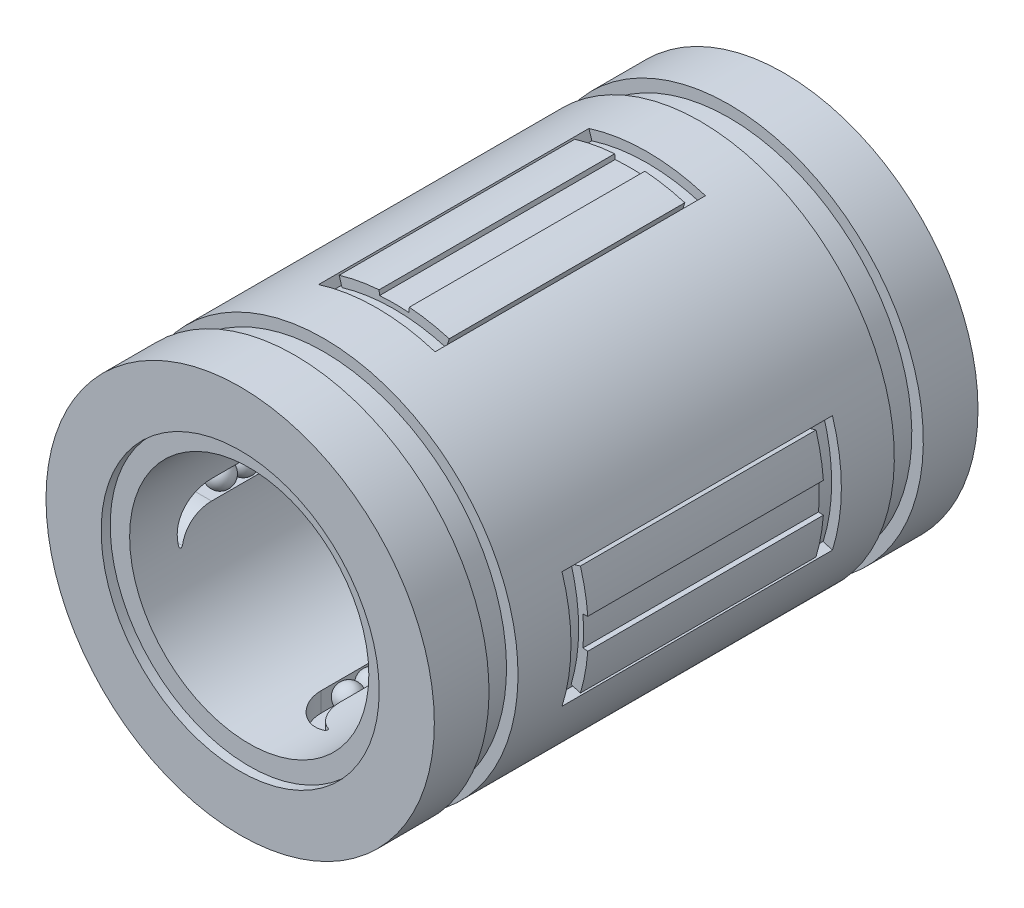
from build123d import *

# Parameters (mm, degrees)
SKETCH3_R               = 7.9375
SKETCH3_R_2             = 4.8895
BOSS_EXTRUDE1_DEPTH     = 11.1125
CUT_EXTRUDE1_START      = -0.370417
SKETCH4_R               = 5.68325
SKETCH4_R_2             = 4.8895
CUT_EXTRUDE1_DEPTH      = 0.370417
CUT_EXTRUDE2_DEPTH      = 5.526617
BOSS_EXTRUDE2_DEPTH     = 4.815417
CUT_EXTRUDE3_REACH      = 17.795
CUT_EXTRUDE3_END_RADIUS = 5.68325
LPATTERN1_COUNT         = 8
LPATTERN1_PITCH         = 0.9525
CIRPATTERN1_COUNT       = 4
CIRPATTERN2_COUNT       = 4
SKETCH9_W               = 1.185333259
SKETCH9_H               = 0.4699


with BuildPart() as part:
    # Sketch3 → Boss-Extrude1 (new, symmetric)
    with BuildSketch(Plane.XY):
        Circle(SKETCH3_R)
        Circle(SKETCH3_R_2, mode=Mode.SUBTRACT)
    extrude(amount=BOSS_EXTRUDE1_DEPTH, both=True)

    # Sketch4 → Cut-Extrude1 (cut)
    with BuildSketch(Plane.XY.offset(11.1125).offset(CUT_EXTRUDE1_START)):
        Circle(SKETCH4_R)
        Circle(SKETCH4_R_2, mode=Mode.SUBTRACT)
    cut_extrude1 = extrude(amount=CUT_EXTRUDE1_DEPTH, mode=Mode.SUBTRACT)

    # Mirror1: Cut-Extrude1 across plane
    add(cut_extrude1.mirror(Plane.XY), mode=Mode.SUBTRACT)

    # Sketch5 → Cut-Extrude2 (cut, symmetric)
    with BuildSketch(Plane.XY):
        with BuildLine():
            Line((-2.38125, 7.571892411), (-2.2621875, 7.193297791))
            ThreePointArc((-2.2621875, 7.193297791), (0, 7.540625), (2.2621875, 7.193297791))
            Line((2.2621875, 7.193297791), (2.38125, 7.571892411))
            ThreePointArc((2.38125, 7.571892411), (0, 7.9375), (-2.38125, 7.571892411))
        make_face()
    cut_extrude2 = extrude(amount=CUT_EXTRUDE2_DEPTH, both=True, mode=Mode.SUBTRACT)

    # Sketch6 → Boss-Extrude2 (add, symmetric)
    with BuildSketch(Plane.XY):
        with BuildLine():
            Line((2.24873958, 7.612297718), (2.136302601, 7.231682832))
            ThreePointArc((2.136302601, 7.231682832), (0, 7.540625), (-2.136302601, 7.231682832))
            Line((-2.136302601, 7.231682832), (-2.24873958, 7.612297718))
            ThreePointArc((-2.24873958, 7.612297718), (-1.440718967, 7.805654047), (-0.616913535, 7.913489997))
            Line((-0.616913535, 7.913489997), (-0.601490697, 7.715652748))
            ThreePointArc((-0.601490697, 7.715652748), (0, 7.7390625), (0.601490697, 7.715652748))
            Line((0.601490697, 7.715652748), (0.616913535, 7.913489997))
            ThreePointArc((0.616913535, 7.913489997), (1.440718967, 7.805654047), (2.24873958, 7.612297718))
        make_face()
    boss_extrude2 = extrude(amount=BOSS_EXTRUDE2_DEPTH, both=True)

    # Cut-Extrude3: up to this cylinder (the profile starts inside it)
    cut_extrude3_end = Plane(origin=(0, 0, 0), z_dir=(0, 0, 1)) * Cylinder(CUT_EXTRUDE3_END_RADIUS, 47.9565, mode=Mode.PRIVATE)
    # Sketch7 → Cut-Extrude3 (cut, up to the surface)
    with BuildSketch(Plane(origin=(0, 0, 0), x_dir=(0, 0, -1), z_dir=(1, 0, 0)), mode=Mode.PRIVATE) as cut_extrude3_sk1:
        with BuildLine():
            Line((-7.408333259, -0.396875), (7.408333259, -0.396875))
            ThreePointArc((7.408333259, -0.396875), (8.197326094, -0.624417904), (8.743984095, -1.237158059))
            ThreePointArc((8.743984095, -1.237158059), (8.824106884, -1.27796122), (8.88457892, -1.211420313))
            ThreePointArc((8.88457892, -1.211420313), (8.499882051, -0.082864857), (7.408333259, 0.396875))
            Line((7.408333259, 0.396875), (-7.408333259, 0.396875))
            ThreePointArc((-7.408333259, 0.396875), (-8.499882051, -0.082864857), (-8.88457892, -1.211420313))
            ThreePointArc((-8.88457892, -1.211420313), (-8.824106884, -1.27796122), (-8.743984095, -1.237158059))
            ThreePointArc((-8.743984095, -1.237158059), (-8.197326094, -0.624417904), (-7.408333259, -0.396875))
        make_face()
    cut_extrude3_tool1 = extrude(cut_extrude3_sk1.sketch, amount=-CUT_EXTRUDE3_REACH, mode=Mode.PRIVATE) & cut_extrude3_end
    cut_extrude3 = cut_extrude3_tool1.solids().sort_by_distance((0, -0.04777, 0))[0]
    add(cut_extrude3, mode=Mode.SUBTRACT)

    # Sketch8 → Revolve1 (revolve)
    with BuildSketch(Plane.XY):
        with BuildLine():
            Line((-5.27137107, 0.50887107), (-5.27137107, -0.50887107))
            ThreePointArc((-5.27137107, -0.50887107), (-4.7625, 0), (-5.27137107, 0.50887107))
        make_face()
    revolve1 = revolve(axis=Axis((-5.27137107, 0.50887107, 0), (0, -1, 0)))

    # LPattern1: Revolve1 ×8
    with Locations(*[(0, 0, -i * LPATTERN1_PITCH) for i in range(1, LPATTERN1_COUNT)]):
        add(revolve1)

    # Mirror2 copy 1 sketch → Mirror2 copy 1 (revolve)
    with BuildSketch(Plane(origin=(0, 0, 0.9525), x_dir=(1, 0, 0), z_dir=(0, 0, -1))):
        with BuildLine():
            Line((-5.27137107, -0.50887107), (-5.27137107, 0.50887107))
            ThreePointArc((-5.27137107, 0.50887107), (-4.7625, 0), (-5.27137107, -0.50887107))
        make_face()
    revolve(axis=Axis((-5.27137107, 0.50887107, 0.9525), (0, 1, 0)))

    # Mirror2 copy 2 sketch → Mirror2 copy 2 (revolve)
    with BuildSketch(Plane(origin=(0, 0, 1.905), x_dir=(1, 0, 0), z_dir=(0, 0, -1))):
        with BuildLine():
            Line((-5.27137107, -0.50887107), (-5.27137107, 0.50887107))
            ThreePointArc((-5.27137107, 0.50887107), (-4.7625, 0), (-5.27137107, -0.50887107))
        make_face()
    revolve(axis=Axis((-5.27137107, 0.50887107, 1.905), (0, 1, 0)))

    # Mirror2 copy 3 sketch → Mirror2 copy 3 (revolve)
    with BuildSketch(Plane(origin=(0, 0, 2.8575), x_dir=(1, 0, 0), z_dir=(0, 0, -1))):
        with BuildLine():
            Line((-5.27137107, -0.50887107), (-5.27137107, 0.50887107))
            ThreePointArc((-5.27137107, 0.50887107), (-4.7625, 0), (-5.27137107, -0.50887107))
        make_face()
    revolve(axis=Axis((-5.27137107, 0.50887107, 2.8575), (0, 1, 0)))

    # Mirror2 copy 4 sketch → Mirror2 copy 4 (revolve)
    with BuildSketch(Plane(origin=(0, 0, 3.81), x_dir=(1, 0, 0), z_dir=(0, 0, -1))):
        with BuildLine():
            Line((-5.27137107, -0.50887107), (-5.27137107, 0.50887107))
            ThreePointArc((-5.27137107, 0.50887107), (-4.7625, 0), (-5.27137107, -0.50887107))
        make_face()
    revolve(axis=Axis((-5.27137107, 0.50887107, 3.81), (0, 1, 0)))

    # Mirror2 copy 5 sketch → Mirror2 copy 5 (revolve)
    with BuildSketch(Plane(origin=(0, 0, 4.7625), x_dir=(1, 0, 0), z_dir=(0, 0, -1))):
        with BuildLine():
            Line((-5.27137107, -0.50887107), (-5.27137107, 0.50887107))
            ThreePointArc((-5.27137107, 0.50887107), (-4.7625, 0), (-5.27137107, -0.50887107))
        make_face()
    revolve(axis=Axis((-5.27137107, 0.50887107, 4.7625), (0, 1, 0)))

    # Mirror2 copy 6 sketch → Mirror2 copy 6 (revolve)
    with BuildSketch(Plane(origin=(0, 0, 5.715), x_dir=(1, 0, 0), z_dir=(0, 0, -1))):
        with BuildLine():
            Line((-5.27137107, -0.50887107), (-5.27137107, 0.50887107))
            ThreePointArc((-5.27137107, 0.50887107), (-4.7625, 0), (-5.27137107, -0.50887107))
        make_face()
    revolve(axis=Axis((-5.27137107, 0.50887107, 5.715), (0, 1, 0)))

    # Mirror2 copy 7 sketch → Mirror2 copy 7 (revolve)
    with BuildSketch(Plane(origin=(0, 0, 6.6675), x_dir=(1, 0, 0), z_dir=(0, 0, -1))):
        with BuildLine():
            Line((-5.27137107, -0.50887107), (-5.27137107, 0.50887107))
            ThreePointArc((-5.27137107, 0.50887107), (-4.7625, 0), (-5.27137107, -0.50887107))
        make_face()
    revolve(axis=Axis((-5.27137107, 0.50887107, 6.6675), (0, 1, 0)))

    # Mirror2 copy 8 sketch → Mirror2 copy 8 (revolve)
    with BuildSketch(Plane(origin=(0, 0, 0), x_dir=(1, 0, 0), z_dir=(0, 0, -1))):
        with BuildLine():
            Line((-5.27137107, -0.50887107), (-5.27137107, 0.50887107))
            ThreePointArc((-5.27137107, 0.50887107), (-4.7625, 0), (-5.27137107, -0.50887107))
        make_face()
    revolve(axis=Axis((-5.27137107, 0.50887107, 0), (0, 1, 0)))

    # CirPattern1: Boss-Extrude2, Cut-Extrude3, Revolve1 ×4 about axis
    cirpattern1_axis = Axis((0, 0, 0), (0, 0, 1))
    add([boss_extrude2.rotate(cirpattern1_axis, i * 360 / CIRPATTERN1_COUNT) for i in range(1, CIRPATTERN1_COUNT)])
    add([cut_extrude3.rotate(cirpattern1_axis, i * 360 / CIRPATTERN1_COUNT) for i in range(1, CIRPATTERN1_COUNT)], mode=Mode.SUBTRACT)
    add([revolve1.rotate(cirpattern1_axis, i * 360 / CIRPATTERN1_COUNT) for i in range(1, CIRPATTERN1_COUNT)])

    # CirPattern1 copy 1 sketch → CirPattern1 copy 1 (revolve)
    with BuildSketch(Plane(origin=(0, 0, -0.9525), x_dir=(0, 1, 0), z_dir=(0, 0, 1))):
        with BuildLine():
            Line((-5.27137107, 0.50887107), (-5.27137107, -0.50887107))
            ThreePointArc((-5.27137107, -0.50887107), (-4.7625, 0), (-5.27137107, 0.50887107))
        make_face()
    revolve(axis=Axis((-0.50887107, -5.27137107, -0.9525), (1, 0, 0)))

    # CirPattern1 copy 2 sketch → CirPattern1 copy 2 (revolve)
    with BuildSketch(Plane(origin=(0, 0, -0.9525), x_dir=(-1, 0, 0), z_dir=(0, 0, 1))):
        with BuildLine():
            Line((-5.27137107, 0.50887107), (-5.27137107, -0.50887107))
            ThreePointArc((-5.27137107, -0.50887107), (-4.7625, 0), (-5.27137107, 0.50887107))
        make_face()
    revolve(axis=Axis((5.27137107, -0.50887107, -0.9525), (0, 1, 0)))

    # CirPattern1 copy 3 sketch → CirPattern1 copy 3 (revolve)
    with BuildSketch(Plane(origin=(0, 0, -0.9525), x_dir=(0, -1, 0), z_dir=(0, 0, 1))):
        with BuildLine():
            Line((-5.27137107, 0.50887107), (-5.27137107, -0.50887107))
            ThreePointArc((-5.27137107, -0.50887107), (-4.7625, 0), (-5.27137107, 0.50887107))
        make_face()
    revolve(axis=Axis((0.50887107, 5.27137107, -0.9525), (-1, 0, 0)))

    # CirPattern1 copy 4 sketch → CirPattern1 copy 4 (revolve)
    with BuildSketch(Plane(origin=(0, 0, -1.905), x_dir=(0, 1, 0), z_dir=(0, 0, 1))):
        with BuildLine():
            Line((-5.27137107, 0.50887107), (-5.27137107, -0.50887107))
            ThreePointArc((-5.27137107, -0.50887107), (-4.7625, 0), (-5.27137107, 0.50887107))
        make_face()
    revolve(axis=Axis((-0.50887107, -5.27137107, -1.905), (1, 0, 0)))

    # CirPattern1 copy 5 sketch → CirPattern1 copy 5 (revolve)
    with BuildSketch(Plane(origin=(0, 0, -1.905), x_dir=(-1, 0, 0), z_dir=(0, 0, 1))):
        with BuildLine():
            Line((-5.27137107, 0.50887107), (-5.27137107, -0.50887107))
            ThreePointArc((-5.27137107, -0.50887107), (-4.7625, 0), (-5.27137107, 0.50887107))
        make_face()
    revolve(axis=Axis((5.27137107, -0.50887107, -1.905), (0, 1, 0)))

    # CirPattern1 copy 6 sketch → CirPattern1 copy 6 (revolve)
    with BuildSketch(Plane(origin=(0, 0, -1.905), x_dir=(0, -1, 0), z_dir=(0, 0, 1))):
        with BuildLine():
            Line((-5.27137107, 0.50887107), (-5.27137107, -0.50887107))
            ThreePointArc((-5.27137107, -0.50887107), (-4.7625, 0), (-5.27137107, 0.50887107))
        make_face()
    revolve(axis=Axis((0.50887107, 5.27137107, -1.905), (-1, 0, 0)))

    # CirPattern1 copy 7 sketch → CirPattern1 copy 7 (revolve)
    with BuildSketch(Plane(origin=(0, 0, -2.8575), x_dir=(0, 1, 0), z_dir=(0, 0, 1))):
        with BuildLine():
            Line((-5.27137107, 0.50887107), (-5.27137107, -0.50887107))
            ThreePointArc((-5.27137107, -0.50887107), (-4.7625, 0), (-5.27137107, 0.50887107))
        make_face()
    revolve(axis=Axis((-0.50887107, -5.27137107, -2.8575), (1, 0, 0)))

    # CirPattern1 copy 8 sketch → CirPattern1 copy 8 (revolve)
    with BuildSketch(Plane(origin=(0, 0, -2.8575), x_dir=(-1, 0, 0), z_dir=(0, 0, 1))):
        with BuildLine():
            Line((-5.27137107, 0.50887107), (-5.27137107, -0.50887107))
            ThreePointArc((-5.27137107, -0.50887107), (-4.7625, 0), (-5.27137107, 0.50887107))
        make_face()
    revolve(axis=Axis((5.27137107, -0.50887107, -2.8575), (0, 1, 0)))

    # CirPattern1 copy 9 sketch → CirPattern1 copy 9 (revolve)
    with BuildSketch(Plane(origin=(0, 0, -2.8575), x_dir=(0, -1, 0), z_dir=(0, 0, 1))):
        with BuildLine():
            Line((-5.27137107, 0.50887107), (-5.27137107, -0.50887107))
            ThreePointArc((-5.27137107, -0.50887107), (-4.7625, 0), (-5.27137107, 0.50887107))
        make_face()
    revolve(axis=Axis((0.50887107, 5.27137107, -2.8575), (-1, 0, 0)))

    # CirPattern1 copy 10 sketch → CirPattern1 copy 10 (revolve)
    with BuildSketch(Plane(origin=(0, 0, -3.81), x_dir=(0, 1, 0), z_dir=(0, 0, 1))):
        with BuildLine():
            Line((-5.27137107, 0.50887107), (-5.27137107, -0.50887107))
            ThreePointArc((-5.27137107, -0.50887107), (-4.7625, 0), (-5.27137107, 0.50887107))
        make_face()
    revolve(axis=Axis((-0.50887107, -5.27137107, -3.81), (1, 0, 0)))

    # CirPattern1 copy 11 sketch → CirPattern1 copy 11 (revolve)
    with BuildSketch(Plane(origin=(0, 0, -3.81), x_dir=(-1, 0, 0), z_dir=(0, 0, 1))):
        with BuildLine():
            Line((-5.27137107, 0.50887107), (-5.27137107, -0.50887107))
            ThreePointArc((-5.27137107, -0.50887107), (-4.7625, 0), (-5.27137107, 0.50887107))
        make_face()
    revolve(axis=Axis((5.27137107, -0.50887107, -3.81), (0, 1, 0)))

    # CirPattern1 copy 12 sketch → CirPattern1 copy 12 (revolve)
    with BuildSketch(Plane(origin=(0, 0, -3.81), x_dir=(0, -1, 0), z_dir=(0, 0, 1))):
        with BuildLine():
            Line((-5.27137107, 0.50887107), (-5.27137107, -0.50887107))
            ThreePointArc((-5.27137107, -0.50887107), (-4.7625, 0), (-5.27137107, 0.50887107))
        make_face()
    revolve(axis=Axis((0.50887107, 5.27137107, -3.81), (-1, 0, 0)))

    # CirPattern1 copy 13 sketch → CirPattern1 copy 13 (revolve)
    with BuildSketch(Plane(origin=(0, 0, -4.7625), x_dir=(0, 1, 0), z_dir=(0, 0, 1))):
        with BuildLine():
            Line((-5.27137107, 0.50887107), (-5.27137107, -0.50887107))
            ThreePointArc((-5.27137107, -0.50887107), (-4.7625, 0), (-5.27137107, 0.50887107))
        make_face()
    revolve(axis=Axis((-0.50887107, -5.27137107, -4.7625), (1, 0, 0)))

    # CirPattern1 copy 14 sketch → CirPattern1 copy 14 (revolve)
    with BuildSketch(Plane(origin=(0, 0, -4.7625), x_dir=(-1, 0, 0), z_dir=(0, 0, 1))):
        with BuildLine():
            Line((-5.27137107, 0.50887107), (-5.27137107, -0.50887107))
            ThreePointArc((-5.27137107, -0.50887107), (-4.7625, 0), (-5.27137107, 0.50887107))
        make_face()
    revolve(axis=Axis((5.27137107, -0.50887107, -4.7625), (0, 1, 0)))

    # CirPattern1 copy 15 sketch → CirPattern1 copy 15 (revolve)
    with BuildSketch(Plane(origin=(0, 0, -4.7625), x_dir=(0, -1, 0), z_dir=(0, 0, 1))):
        with BuildLine():
            Line((-5.27137107, 0.50887107), (-5.27137107, -0.50887107))
            ThreePointArc((-5.27137107, -0.50887107), (-4.7625, 0), (-5.27137107, 0.50887107))
        make_face()
    revolve(axis=Axis((0.50887107, 5.27137107, -4.7625), (-1, 0, 0)))

    # CirPattern1 copy 16 sketch → CirPattern1 copy 16 (revolve)
    with BuildSketch(Plane(origin=(0, 0, -5.715), x_dir=(0, 1, 0), z_dir=(0, 0, 1))):
        with BuildLine():
            Line((-5.27137107, 0.50887107), (-5.27137107, -0.50887107))
            ThreePointArc((-5.27137107, -0.50887107), (-4.7625, 0), (-5.27137107, 0.50887107))
        make_face()
    revolve(axis=Axis((-0.50887107, -5.27137107, -5.715), (1, 0, 0)))

    # CirPattern1 copy 17 sketch → CirPattern1 copy 17 (revolve)
    with BuildSketch(Plane(origin=(0, 0, -5.715), x_dir=(-1, 0, 0), z_dir=(0, 0, 1))):
        with BuildLine():
            Line((-5.27137107, 0.50887107), (-5.27137107, -0.50887107))
            ThreePointArc((-5.27137107, -0.50887107), (-4.7625, 0), (-5.27137107, 0.50887107))
        make_face()
    revolve(axis=Axis((5.27137107, -0.50887107, -5.715), (0, 1, 0)))

    # CirPattern1 copy 18 sketch → CirPattern1 copy 18 (revolve)
    with BuildSketch(Plane(origin=(0, 0, -5.715), x_dir=(0, -1, 0), z_dir=(0, 0, 1))):
        with BuildLine():
            Line((-5.27137107, 0.50887107), (-5.27137107, -0.50887107))
            ThreePointArc((-5.27137107, -0.50887107), (-4.7625, 0), (-5.27137107, 0.50887107))
        make_face()
    revolve(axis=Axis((0.50887107, 5.27137107, -5.715), (-1, 0, 0)))

    # CirPattern1 copy 19 sketch → CirPattern1 copy 19 (revolve)
    with BuildSketch(Plane(origin=(0, 0, -6.6675), x_dir=(0, 1, 0), z_dir=(0, 0, 1))):
        with BuildLine():
            Line((-5.27137107, 0.50887107), (-5.27137107, -0.50887107))
            ThreePointArc((-5.27137107, -0.50887107), (-4.7625, 0), (-5.27137107, 0.50887107))
        make_face()
    revolve(axis=Axis((-0.50887107, -5.27137107, -6.6675), (1, 0, 0)))

    # CirPattern1 copy 20 sketch → CirPattern1 copy 20 (revolve)
    with BuildSketch(Plane(origin=(0, 0, -6.6675), x_dir=(-1, 0, 0), z_dir=(0, 0, 1))):
        with BuildLine():
            Line((-5.27137107, 0.50887107), (-5.27137107, -0.50887107))
            ThreePointArc((-5.27137107, -0.50887107), (-4.7625, 0), (-5.27137107, 0.50887107))
        make_face()
    revolve(axis=Axis((5.27137107, -0.50887107, -6.6675), (0, 1, 0)))

    # CirPattern1 copy 21 sketch → CirPattern1 copy 21 (revolve)
    with BuildSketch(Plane(origin=(0, 0, -6.6675), x_dir=(0, -1, 0), z_dir=(0, 0, 1))):
        with BuildLine():
            Line((-5.27137107, 0.50887107), (-5.27137107, -0.50887107))
            ThreePointArc((-5.27137107, -0.50887107), (-4.7625, 0), (-5.27137107, 0.50887107))
        make_face()
    revolve(axis=Axis((0.50887107, 5.27137107, -6.6675), (-1, 0, 0)))

    # CirPattern1 copy 22 sketch → CirPattern1 copy 22 (revolve)
    with BuildSketch(Plane.YX.offset(-0.9525)):
        with BuildLine():
            Line((-5.27137107, -0.50887107), (-5.27137107, 0.50887107))
            ThreePointArc((-5.27137107, 0.50887107), (-4.7625, 0), (-5.27137107, -0.50887107))
        make_face()
    revolve(axis=Axis((-0.50887107, -5.27137107, 0.9525), (-1, 0, 0)))

    # CirPattern1 copy 23 sketch → CirPattern1 copy 23 (revolve)
    with BuildSketch(Plane(origin=(0, 0, 0.9525), x_dir=(-1, 0, 0), z_dir=(0, 0, -1))):
        with BuildLine():
            Line((-5.27137107, -0.50887107), (-5.27137107, 0.50887107))
            ThreePointArc((-5.27137107, 0.50887107), (-4.7625, 0), (-5.27137107, -0.50887107))
        make_face()
    revolve(axis=Axis((5.27137107, -0.50887107, 0.9525), (0, -1, 0)))

    # CirPattern1 copy 24 sketch → CirPattern1 copy 24 (revolve)
    with BuildSketch(Plane(origin=(0, 0, 0.9525), x_dir=(0, -1, 0), z_dir=(0, 0, -1))):
        with BuildLine():
            Line((-5.27137107, -0.50887107), (-5.27137107, 0.50887107))
            ThreePointArc((-5.27137107, 0.50887107), (-4.7625, 0), (-5.27137107, -0.50887107))
        make_face()
    revolve(axis=Axis((0.50887107, 5.27137107, 0.9525), (1, 0, 0)))

    # CirPattern1 copy 25 sketch → CirPattern1 copy 25 (revolve)
    with BuildSketch(Plane.YX.offset(-1.905)):
        with BuildLine():
            Line((-5.27137107, -0.50887107), (-5.27137107, 0.50887107))
            ThreePointArc((-5.27137107, 0.50887107), (-4.7625, 0), (-5.27137107, -0.50887107))
        make_face()
    revolve(axis=Axis((-0.50887107, -5.27137107, 1.905), (-1, 0, 0)))

    # CirPattern1 copy 26 sketch → CirPattern1 copy 26 (revolve)
    with BuildSketch(Plane(origin=(0, 0, 1.905), x_dir=(-1, 0, 0), z_dir=(0, 0, -1))):
        with BuildLine():
            Line((-5.27137107, -0.50887107), (-5.27137107, 0.50887107))
            ThreePointArc((-5.27137107, 0.50887107), (-4.7625, 0), (-5.27137107, -0.50887107))
        make_face()
    revolve(axis=Axis((5.27137107, -0.50887107, 1.905), (0, -1, 0)))

    # CirPattern1 copy 27 sketch → CirPattern1 copy 27 (revolve)
    with BuildSketch(Plane(origin=(0, 0, 1.905), x_dir=(0, -1, 0), z_dir=(0, 0, -1))):
        with BuildLine():
            Line((-5.27137107, -0.50887107), (-5.27137107, 0.50887107))
            ThreePointArc((-5.27137107, 0.50887107), (-4.7625, 0), (-5.27137107, -0.50887107))
        make_face()
    revolve(axis=Axis((0.50887107, 5.27137107, 1.905), (1, 0, 0)))

    # CirPattern1 copy 28 sketch → CirPattern1 copy 28 (revolve)
    with BuildSketch(Plane.YX.offset(-2.8575)):
        with BuildLine():
            Line((-5.27137107, -0.50887107), (-5.27137107, 0.50887107))
            ThreePointArc((-5.27137107, 0.50887107), (-4.7625, 0), (-5.27137107, -0.50887107))
        make_face()
    revolve(axis=Axis((-0.50887107, -5.27137107, 2.8575), (-1, 0, 0)))

    # CirPattern1 copy 29 sketch → CirPattern1 copy 29 (revolve)
    with BuildSketch(Plane(origin=(0, 0, 2.8575), x_dir=(-1, 0, 0), z_dir=(0, 0, -1))):
        with BuildLine():
            Line((-5.27137107, -0.50887107), (-5.27137107, 0.50887107))
            ThreePointArc((-5.27137107, 0.50887107), (-4.7625, 0), (-5.27137107, -0.50887107))
        make_face()
    revolve(axis=Axis((5.27137107, -0.50887107, 2.8575), (0, -1, 0)))

    # CirPattern1 copy 30 sketch → CirPattern1 copy 30 (revolve)
    with BuildSketch(Plane(origin=(0, 0, 2.8575), x_dir=(0, -1, 0), z_dir=(0, 0, -1))):
        with BuildLine():
            Line((-5.27137107, -0.50887107), (-5.27137107, 0.50887107))
            ThreePointArc((-5.27137107, 0.50887107), (-4.7625, 0), (-5.27137107, -0.50887107))
        make_face()
    revolve(axis=Axis((0.50887107, 5.27137107, 2.8575), (1, 0, 0)))

    # CirPattern1 copy 31 sketch → CirPattern1 copy 31 (revolve)
    with BuildSketch(Plane.YX.offset(-3.81)):
        with BuildLine():
            Line((-5.27137107, -0.50887107), (-5.27137107, 0.50887107))
            ThreePointArc((-5.27137107, 0.50887107), (-4.7625, 0), (-5.27137107, -0.50887107))
        make_face()
    revolve(axis=Axis((-0.50887107, -5.27137107, 3.81), (-1, 0, 0)))

    # CirPattern1 copy 32 sketch → CirPattern1 copy 32 (revolve)
    with BuildSketch(Plane(origin=(0, 0, 3.81), x_dir=(-1, 0, 0), z_dir=(0, 0, -1))):
        with BuildLine():
            Line((-5.27137107, -0.50887107), (-5.27137107, 0.50887107))
            ThreePointArc((-5.27137107, 0.50887107), (-4.7625, 0), (-5.27137107, -0.50887107))
        make_face()
    revolve(axis=Axis((5.27137107, -0.50887107, 3.81), (0, -1, 0)))

    # CirPattern1 copy 33 sketch → CirPattern1 copy 33 (revolve)
    with BuildSketch(Plane(origin=(0, 0, 3.81), x_dir=(0, -1, 0), z_dir=(0, 0, -1))):
        with BuildLine():
            Line((-5.27137107, -0.50887107), (-5.27137107, 0.50887107))
            ThreePointArc((-5.27137107, 0.50887107), (-4.7625, 0), (-5.27137107, -0.50887107))
        make_face()
    revolve(axis=Axis((0.50887107, 5.27137107, 3.81), (1, 0, 0)))

    # CirPattern1 copy 34 sketch → CirPattern1 copy 34 (revolve)
    with BuildSketch(Plane.YX.offset(-4.7625)):
        with BuildLine():
            Line((-5.27137107, -0.50887107), (-5.27137107, 0.50887107))
            ThreePointArc((-5.27137107, 0.50887107), (-4.7625, 0), (-5.27137107, -0.50887107))
        make_face()
    revolve(axis=Axis((-0.50887107, -5.27137107, 4.7625), (-1, 0, 0)))

    # CirPattern1 copy 35 sketch → CirPattern1 copy 35 (revolve)
    with BuildSketch(Plane(origin=(0, 0, 4.7625), x_dir=(-1, 0, 0), z_dir=(0, 0, -1))):
        with BuildLine():
            Line((-5.27137107, -0.50887107), (-5.27137107, 0.50887107))
            ThreePointArc((-5.27137107, 0.50887107), (-4.7625, 0), (-5.27137107, -0.50887107))
        make_face()
    revolve(axis=Axis((5.27137107, -0.50887107, 4.7625), (0, -1, 0)))

    # CirPattern1 copy 36 sketch → CirPattern1 copy 36 (revolve)
    with BuildSketch(Plane(origin=(0, 0, 4.7625), x_dir=(0, -1, 0), z_dir=(0, 0, -1))):
        with BuildLine():
            Line((-5.27137107, -0.50887107), (-5.27137107, 0.50887107))
            ThreePointArc((-5.27137107, 0.50887107), (-4.7625, 0), (-5.27137107, -0.50887107))
        make_face()
    revolve(axis=Axis((0.50887107, 5.27137107, 4.7625), (1, 0, 0)))

    # CirPattern1 copy 37 sketch → CirPattern1 copy 37 (revolve)
    with BuildSketch(Plane.YX.offset(-5.715)):
        with BuildLine():
            Line((-5.27137107, -0.50887107), (-5.27137107, 0.50887107))
            ThreePointArc((-5.27137107, 0.50887107), (-4.7625, 0), (-5.27137107, -0.50887107))
        make_face()
    revolve(axis=Axis((-0.50887107, -5.27137107, 5.715), (-1, 0, 0)))

    # CirPattern1 copy 38 sketch → CirPattern1 copy 38 (revolve)
    with BuildSketch(Plane(origin=(0, 0, 5.715), x_dir=(-1, 0, 0), z_dir=(0, 0, -1))):
        with BuildLine():
            Line((-5.27137107, -0.50887107), (-5.27137107, 0.50887107))
            ThreePointArc((-5.27137107, 0.50887107), (-4.7625, 0), (-5.27137107, -0.50887107))
        make_face()
    revolve(axis=Axis((5.27137107, -0.50887107, 5.715), (0, -1, 0)))

    # CirPattern1 copy 39 sketch → CirPattern1 copy 39 (revolve)
    with BuildSketch(Plane(origin=(0, 0, 5.715), x_dir=(0, -1, 0), z_dir=(0, 0, -1))):
        with BuildLine():
            Line((-5.27137107, -0.50887107), (-5.27137107, 0.50887107))
            ThreePointArc((-5.27137107, 0.50887107), (-4.7625, 0), (-5.27137107, -0.50887107))
        make_face()
    revolve(axis=Axis((0.50887107, 5.27137107, 5.715), (1, 0, 0)))

    # CirPattern1 copy 40 sketch → CirPattern1 copy 40 (revolve)
    with BuildSketch(Plane.YX.offset(-6.6675)):
        with BuildLine():
            Line((-5.27137107, -0.50887107), (-5.27137107, 0.50887107))
            ThreePointArc((-5.27137107, 0.50887107), (-4.7625, 0), (-5.27137107, -0.50887107))
        make_face()
    revolve(axis=Axis((-0.50887107, -5.27137107, 6.6675), (-1, 0, 0)))

    # CirPattern1 copy 41 sketch → CirPattern1 copy 41 (revolve)
    with BuildSketch(Plane(origin=(0, 0, 6.6675), x_dir=(-1, 0, 0), z_dir=(0, 0, -1))):
        with BuildLine():
            Line((-5.27137107, -0.50887107), (-5.27137107, 0.50887107))
            ThreePointArc((-5.27137107, 0.50887107), (-4.7625, 0), (-5.27137107, -0.50887107))
        make_face()
    revolve(axis=Axis((5.27137107, -0.50887107, 6.6675), (0, -1, 0)))

    # CirPattern1 copy 42 sketch → CirPattern1 copy 42 (revolve)
    with BuildSketch(Plane(origin=(0, 0, 6.6675), x_dir=(0, -1, 0), z_dir=(0, 0, -1))):
        with BuildLine():
            Line((-5.27137107, -0.50887107), (-5.27137107, 0.50887107))
            ThreePointArc((-5.27137107, 0.50887107), (-4.7625, 0), (-5.27137107, -0.50887107))
        make_face()
    revolve(axis=Axis((0.50887107, 5.27137107, 6.6675), (1, 0, 0)))

    # CirPattern1 copy 43 sketch → CirPattern1 copy 43 (revolve)
    with BuildSketch(Plane.YX):
        with BuildLine():
            Line((-5.27137107, -0.50887107), (-5.27137107, 0.50887107))
            ThreePointArc((-5.27137107, 0.50887107), (-4.7625, 0), (-5.27137107, -0.50887107))
        make_face()
    revolve(axis=Axis((-0.50887107, -5.27137107, 0), (-1, 0, 0)))

    # CirPattern1 copy 44 sketch → CirPattern1 copy 44 (revolve)
    with BuildSketch(Plane(origin=(0, 0, 0), x_dir=(-1, 0, 0), z_dir=(0, 0, -1))):
        with BuildLine():
            Line((-5.27137107, -0.50887107), (-5.27137107, 0.50887107))
            ThreePointArc((-5.27137107, 0.50887107), (-4.7625, 0), (-5.27137107, -0.50887107))
        make_face()
    revolve(axis=Axis((5.27137107, -0.50887107, 0), (0, -1, 0)))

    # CirPattern1 copy 45 sketch → CirPattern1 copy 45 (revolve)
    with BuildSketch(Plane(origin=(0, 0, 0), x_dir=(0, -1, 0), z_dir=(0, 0, -1))):
        with BuildLine():
            Line((-5.27137107, -0.50887107), (-5.27137107, 0.50887107))
            ThreePointArc((-5.27137107, 0.50887107), (-4.7625, 0), (-5.27137107, -0.50887107))
        make_face()
    revolve(axis=Axis((0.50887107, 5.27137107, 0), (1, 0, 0)))

    # CirPattern2: Cut-Extrude2, Boss-Extrude2 ×4 about axis
    cirpattern2_axis = Axis((0, 0, 11.1125), (0, 0, -1))
    add([cut_extrude2.rotate(cirpattern2_axis, i * 360 / CIRPATTERN2_COUNT) for i in range(1, CIRPATTERN2_COUNT)], mode=Mode.SUBTRACT)
    add([boss_extrude2.rotate(cirpattern2_axis, i * 360 / CIRPATTERN2_COUNT) for i in range(1, CIRPATTERN2_COUNT)])

    # Sketch9 → Cut-Revolve1 (revolve, cut)
    with BuildSketch(Plane(origin=(0, 0, 0), x_dir=(0, 0, -1), z_dir=(1, 0, 0))):
        with Locations((8.28463337, 7.70255)):
            Rectangle(SKETCH9_W, SKETCH9_H)
        with Locations((-8.28463337, 7.70255)):
            Rectangle(SKETCH9_W, SKETCH9_H)
    revolve(axis=Axis((0, 0, -11.1125), (0, 0, 1)), mode=Mode.SUBTRACT)


solid = part.part
